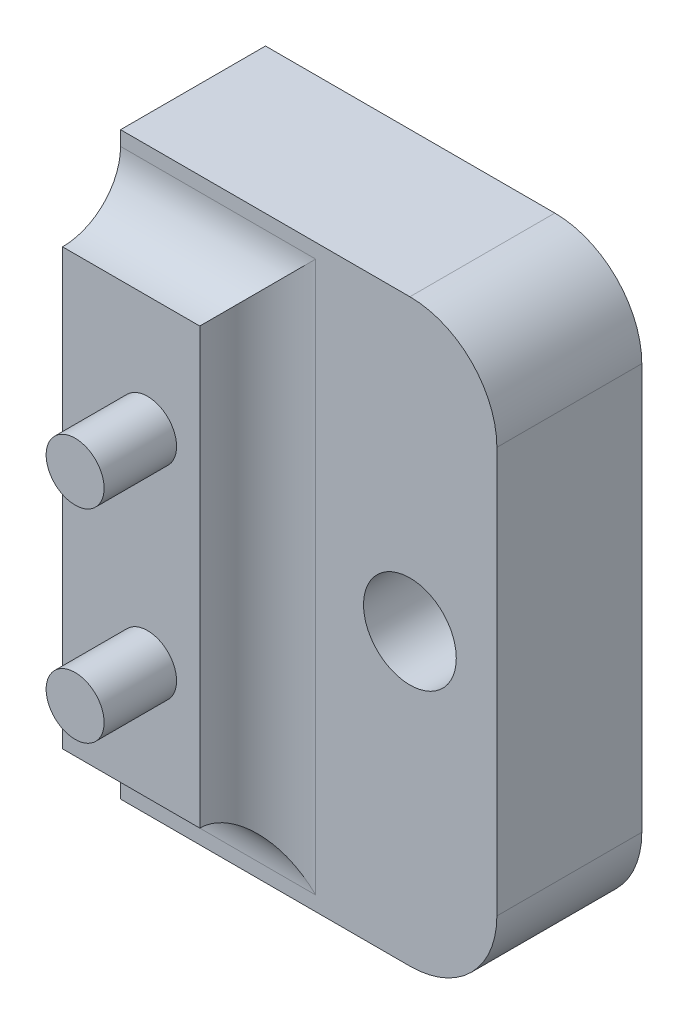
from build123d import *

# Parameters (mm, degrees)
CROQUIS1_R                 = 1.6
SALIENTE_EXTRUIR1_DEPTH    = 5
CROQUIS2_W                 = 6.75
CROQUIS2_H                 = 15
SALIENTE_EXTRUIR2_DEPTH    = 2
REDONDEO1_R                = 2
CROQUIS3_R                 = 1
SALIENTE_EXTRUIR3_DEPTH    = 2.5
CORTAR_EXTRUIR2_DEPTH      = 6
CORTAR_EXTRUIR2_DEPTH_BACK = 6
CROQUIS4_W                 = 6.920457475
CROQUIS4_H                 = 24.995599696


with BuildPart() as part:
    # Croquis1 → Saliente-Extruir1 (new body)
    with BuildSketch(Plane.XY):
        with BuildLine():
            Line((0, 0), (12, 0))
            ThreePointArc((12, 0), (14.121320344, 0.878679656), (15, 3))
            Line((15, 3), (15, 17))
            ThreePointArc((15, 17), (14.121320344, 19.121320344), (12, 20))
            Line((12, 20), (0, 20))
            Line((0, 20), (0, 0))
        make_face()
        with Locations((12, 10)):
            Circle(CROQUIS1_R, mode=Mode.SUBTRACT)
    extrude(amount=SALIENTE_EXTRUIR1_DEPTH)

    # Croquis2 → Saliente-Extruir2 (add)
    with BuildSketch(Plane.XY.offset(5)):
        with Locations((3.375, 10)):
            Rectangle(CROQUIS2_W, CROQUIS2_H)
    extrude(amount=SALIENTE_EXTRUIR2_DEPTH)

    # Redondeo1
    redondeo1_edges = [part.edges().sort_by_distance(p)[0] for p in [
        (3.375, 17.5, 5),
        (6.75, 10, 5),
        (3.375, 2.5, 5),
    ]]
    fillet(redondeo1_edges, radius=REDONDEO1_R - 0.0001)  # a hair under: the kernel refuses the full size

    # Croquis3 → Saliente-Extruir3 (add)
    with BuildSketch(Plane.XY.offset(7)):
        with Locations((4.95023571, 13.5)):
            Circle(CROQUIS3_R)
        with Locations((4.95023571, 6.5)):
            Circle(CROQUIS3_R)
    extrude(amount=SALIENTE_EXTRUIR3_DEPTH)

    # Croquis4 → Cortar-Extruir2 (cut, two sides: drawn at the far end of the back side and taken through both)
    with BuildSketch(Plane.XY.offset(5).offset(-CORTAR_EXTRUIR2_DEPTH_BACK)):
        with Locations((-1.442627952, 9.887678484)):
            Rectangle(CROQUIS4_W, CROQUIS4_H)
    extrude(amount=CORTAR_EXTRUIR2_DEPTH + CORTAR_EXTRUIR2_DEPTH_BACK, mode=Mode.SUBTRACT)


solid = part.part
